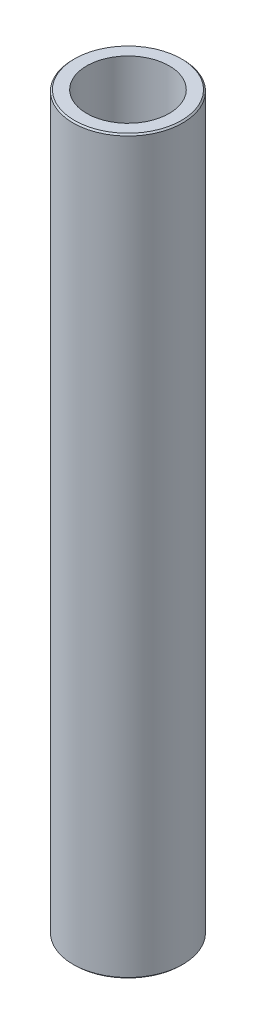
from build123d import *

# Parameters (mm, degrees)
SKETCH1_R           = 45
BOSS_EXTRUDE1_DEPTH = 600
SKETCH2_R           = 33.835595186
CUT_EXTRUDE1_DEPTH  = 604.365560834
CHAMFER1_SIZE       = 1.166437864


with BuildPart() as part:
    # Sketch1 → Boss-Extrude1 (new body)
    with BuildSketch(Plane(origin=(0, 0, 0), x_dir=(1, 0, 0), z_dir=(0, 1, 0))):
        Circle(SKETCH1_R)
    extrude(amount=BOSS_EXTRUDE1_DEPTH)

    # Sketch2 → Cut-Extrude1 (cut, through all)
    with BuildSketch(Plane(origin=(0, 0, 0), x_dir=(1, 0, 0), z_dir=(0, 1, 0))):
        Circle(SKETCH2_R)
    extrude(amount=CUT_EXTRUDE1_DEPTH, mode=Mode.SUBTRACT)

    # Chamfer1
    chamfer1_edges = [part.edges().sort_by_distance(p)[0] for p in [
        (-45, 600, 0),
        (-45, 0, 0),
    ]]
    chamfer(chamfer1_edges, length=CHAMFER1_SIZE)


solid = part.part
